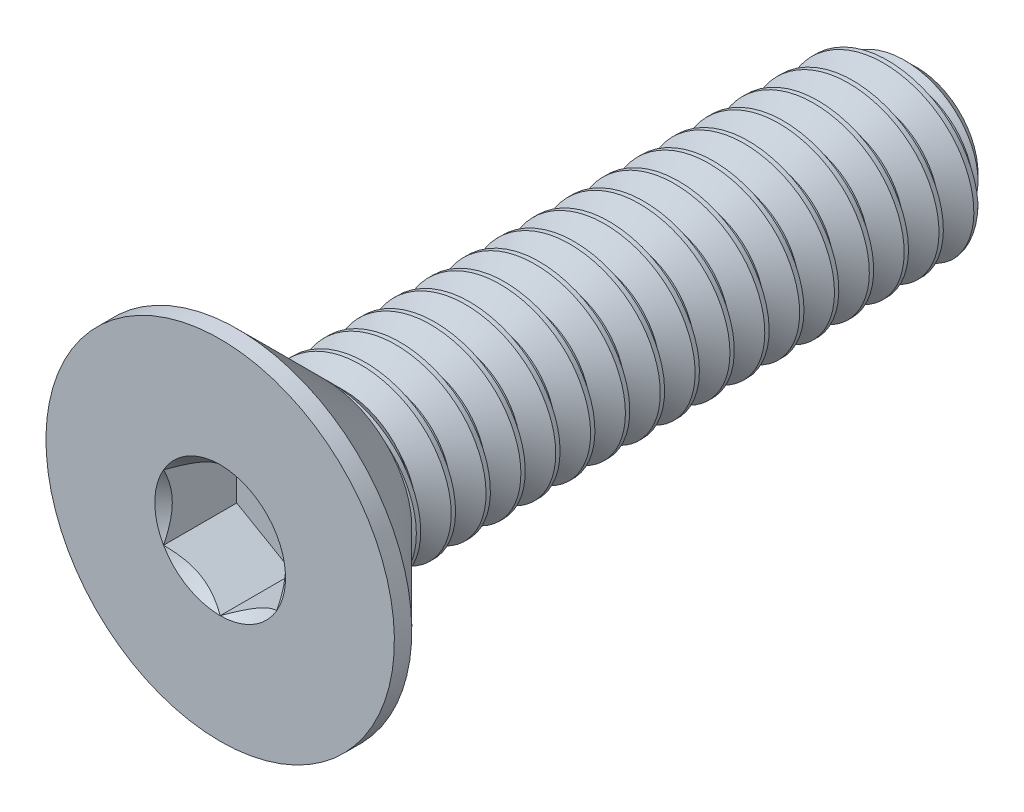
from build123d import *
from build123d.topology import SkipClean

# Parameters (mm, degrees)
SKETCH1_W          = 8
SKETCH1_H          = 1
CHAMFER1_SIZE      = 0.3
CUT_SWEEP1_PITCH   = 0.4
CUT_EXTRUDE2_DEPTH = 0.84


with BuildPart() as part:
    # Sketch1 → Revolve1 (revolve)
    with BuildSketch(Plane(origin=(0, 0, 0), x_dir=(0, 0, -1), z_dir=(1, 0, 0))):
        with Locations((4, 0.5)):
            Rectangle(SKETCH1_W, SKETCH1_H)
    revolve(axis=Axis((0, 0, -8), (0, 0, 1)))

    # Chamfer1
    chamfer1_edges = [part.edges().sort_by_distance(p)[0] for p in [
        (0, -1, -8),
    ]]
    chamfer(chamfer1_edges, length=CHAMFER1_SIZE)

    # Cut-Sweep1: the profile of Sketch2 profile screwed along a right-hand helix of 20 turns, 6 arcs to a turn; built about Z, then put on its axis
    cut_sweep1_z = Axis((0, 0, 0), (0, 0, 1))
    cut_sweep1_corners = [(1.0006, 0, 0.00034641), (1.0006, 0, -0.35034641), (0.740192379, 0, -0.2), (0.740192379, 0, -0.15)]
    with BuildLine(mode=Mode.PRIVATE) as cut_sweep1_profile:
        Line(cut_sweep1_corners[0], cut_sweep1_corners[1])
        Line(cut_sweep1_corners[1], cut_sweep1_corners[2])
        Line(cut_sweep1_corners[2], cut_sweep1_corners[3])
        Line(cut_sweep1_corners[3], cut_sweep1_corners[0])
    cut_sweep1_cap = Face(cut_sweep1_profile.wire())
    cut_sweep1_turn_angles = [0, 30, 60, 90, 120, 150, 180, 210, 240, 270, 300, 330, 360]
    cut_sweep1_turn_weights = [1, 0.8660254037844387, 1, 0.8660254037844387, 1, 0.8660254037844387, 1, 0.8660254037844387, 1, 0.8660254037844387, 1, 0.8660254037844387, 1]
    cut_sweep1_turn_rails = [Edge.make_bspline([Vector(p[0], p[1], 0).rotate(cut_sweep1_z, cut_sweep1_turn_angles[k]) / cut_sweep1_turn_weights[k] + Vector(0, 0, p[2] + CUT_SWEEP1_PITCH * cut_sweep1_turn_angles[k] / 360) for k in range(13)], [0, 0, 0, 1, 1, 2, 2, 3, 3, 4, 4, 5, 5, 6, 6, 6], 2, cut_sweep1_turn_weights) for p in cut_sweep1_corners]
    cut_sweep1_turn_sides = [Face.make_surface_from_curves(cut_sweep1_turn_rails[p[0]], cut_sweep1_turn_rails[p[1]]) for p in [(0, 1), (1, 2), (2, 3), (3, 0)]]
    cut_sweep1 = Plane(origin=(0, 0, -8), x_dir=(0, 1, 0), z_dir=(0, 0, 1)) * Solid(Shell([*[p.moved(Location((0, 0, CUT_SWEEP1_PITCH * i))) for i in range(20) for p in cut_sweep1_turn_sides], cut_sweep1_cap, cut_sweep1_cap.rotate(cut_sweep1_z, 7200).moved(Location((0, 0, CUT_SWEEP1_PITCH * 7200 / 360)))]))
    add(cut_sweep1, mode=Mode.SUBTRACT)

    # Sketch7 → Revolve2 (revolve)
    with BuildSketch(Plane(origin=(0, 0, 0), x_dir=(0, 0, -1), z_dir=(1, 0, 0)), mode=Mode.PRIVATE) as revolve2_sk:
        Polygon((0, 2), (0.2, 2), (1.2, 1), (1.2, 0), (0, 0), align=None)
    revolve(revolve2_sk.sketch.rotate(Axis((0, 0, 0), (0, 0, -1)), 189.336081704), axis=Axis((0, 0, 0), (0, 0, -1)))

    # Boss-Extrude1 cone 1 section (through the dimple's axis) → Boss-Extrude1 (revolve)
    with SkipClean():  # the faces are left unmerged after this step: merging them gives an invalid solid
        with BuildSketch(Plane(origin=(0, 0, -1.2), x_dir=(0, -1, 0), z_dir=(1, 0, 0))):
            Polygon((0, 0), (1, 0), (0, 1), align=None)
        revolve(axis=Axis((0, 0, -1.2), (0, 0, -1)))

    # Sketch5 → Cut-Extrude2 (cut)
    with SkipClean():  # the faces are left unmerged after this step: merging them gives an invalid solid
        with BuildSketch(Plane.XY):
            Polygon((0.65, -0.375277675), (0.65, 0.375277675), (0, 0.75055535), (-0.65, 0.375277675), (-0.65, -0.375277675), (0, -0.75055535), align=None)
        extrude(amount=-CUT_EXTRUDE2_DEPTH, mode=Mode.SUBTRACT)

    # Cut-Extrude3 cone 1 section (through the dimple's axis) → Cut-Extrude3 (revolve, cut)
    with SkipClean():  # the faces are left unmerged after this step: merging them gives an invalid solid
        with BuildSketch(Plane(origin=(0, 0, 0), x_dir=(0, -1, 0), z_dir=(1, 0, 0))):
            Polygon((0, 0), (0.75055535, 0), (0, 0.75055535), align=None)
        revolve(axis=Axis((0, 0, 0), (0, 0, -1)), mode=Mode.SUBTRACT)


solid = part.part
